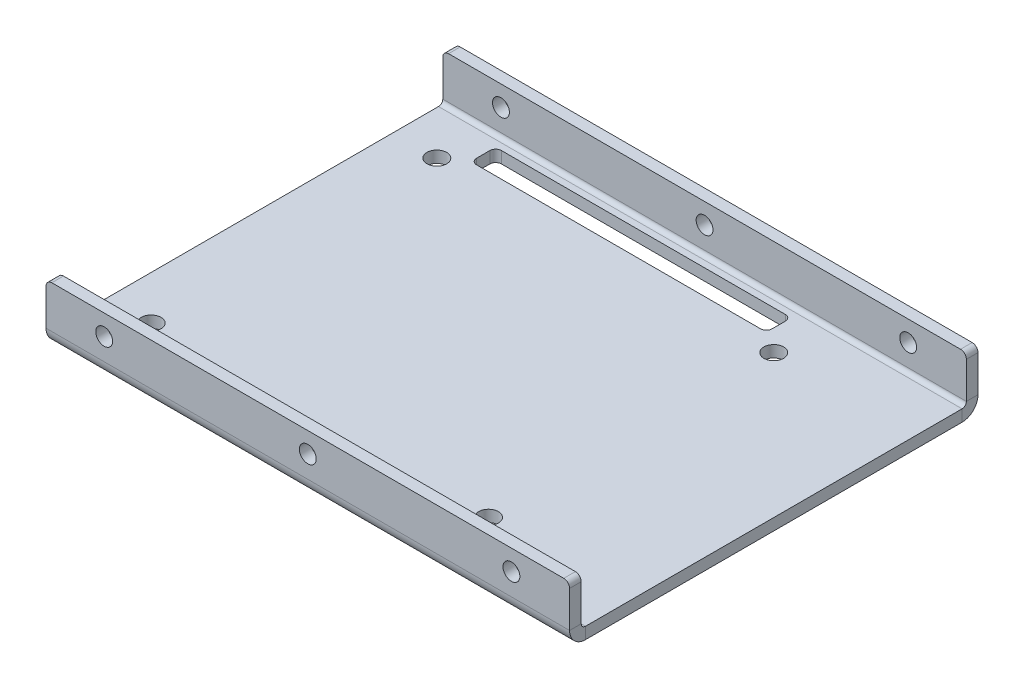
from build123d import *

# Parameters (mm, degrees)
SKETCH_1_W                         = 90
SKETCH_1_H                         = 70.2
SM_BASE_FLANGE_1_DEPTH             = 2
SM_EDGE_FLANGE_1_STRIP_W           = 9.4732
SM_EDGE_FLANGE_1_STRIP_H           = 2
SM_EDGE_FLANGE_1_STRIP_CUT_DEPTH   = 90
SM_EDGE_FLANGE_1_STRIP_2_W         = 9.4732
SM_EDGE_FLANGE_1_STRIP_2_H         = 2
SM_EDGE_FLANGE_1_STRIP_CUT_2_DEPTH = 90
SM_EDGE_FLANGE_1_DEPTH             = 90
SM_EDGE_FLANGE_1_BEND_DEPTH        = 90
SKETCH_12_W                        = 50.800050643
SKETCH_12_H                        = 4.268431417
CUT_EXTRUDE_1_DEPTH                = 10
FILLET_1_R                         = 1
FILLET_2_R                         = 1
HOLE_WIZARD_M2_5_2_D               = 2.9
HOLE_WIZARD_M3_1_D                 = 3.4


# Sheet-metal steps are written as plain solids
with BuildPart() as part:
    # Sketch 1 → 基体-法兰1 (new body)
    with BuildSketch(Plane(origin=(0, 0, 0), x_dir=(1, 0, 0), z_dir=(0, 1, 0))):
        Rectangle(SKETCH_1_W, SKETCH_1_H)
    extrude(amount=-SM_BASE_FLANGE_1_DEPTH)

    # 边线-法兰1 strip (across the edge) → 边线-法兰1 strip cut (cut)
    with BuildSketch(Plane(origin=(-45, 0, 35.1), x_dir=(0, 0, -1), z_dir=(1, 0, 0))):
        with Locations((-2, -1)):
            Rectangle(SM_EDGE_FLANGE_1_STRIP_W, SM_EDGE_FLANGE_1_STRIP_H)
    extrude(amount=SM_EDGE_FLANGE_1_STRIP_CUT_DEPTH, mode=Mode.SUBTRACT)

    # 边线-法兰1 strip 2 (across the edge) → 边线-法兰1 strip cut 2 (cut)
    with BuildSketch(Plane(origin=(45, 0, -35.1), x_dir=(0, 0, 1), z_dir=(-1, 0, 0))):
        with Locations((-2, -1)):
            Rectangle(SM_EDGE_FLANGE_1_STRIP_2_W, SM_EDGE_FLANGE_1_STRIP_2_H)
    extrude(amount=SM_EDGE_FLANGE_1_STRIP_CUT_2_DEPTH, mode=Mode.SUBTRACT)

    # 边线-法兰1 section (across the edge) → 边线-法兰1 (add)
    with BuildSketch(Plane(origin=(-45, 0, 35.1), x_dir=(0, 0, -1), z_dir=(1, 0, 0))):
        with BuildLine():
            Line((0, 0.7366), (0, 8))
            Line((0, 8), (2, 8))
            Line((2, 8), (2, 0.7366))
            ThreePointArc((2, 0.7366), (2.215745145, 0.215745145), (2.7366, 0))
            Line((2.7366, 0), (2.7366, -2))
            ThreePointArc((2.7366, -2), (0.801531583, -1.198468417), (0, 0.7366))
        make_face()
    extrude(amount=SM_EDGE_FLANGE_1_DEPTH)

    # 边线-法兰1 section 2 (across the edge) → 边线-法兰1 bend (add)
    with BuildSketch(Plane(origin=(45, 0, -35.1), x_dir=(0, 0, 1), z_dir=(-1, 0, 0))):
        with BuildLine():
            Line((0, 0.7366), (0, 8))
            Line((0, 8), (2, 8))
            Line((2, 8), (2, 0.7366))
            ThreePointArc((2, 0.7366), (2.215745145, 0.215745145), (2.7366, 0))
            Line((2.7366, 0), (2.7366, -2))
            ThreePointArc((2.7366, -2), (0.801531583, -1.198468417), (0, 0.7366))
        make_face()
    extrude(amount=SM_EDGE_FLANGE_1_BEND_DEPTH)

    # 草图12 → 切除-拉伸1 (cut)
    with BuildSketch(Plane(origin=(0, 0, 0), x_dir=(1, 0, 0), z_dir=(0, 1, 0))):
        with Locations((-8.635838808, 29.089367058)):
            Rectangle(SKETCH_12_W, SKETCH_12_H)
    extrude(amount=-CUT_EXTRUDE_1_DEPTH, mode=Mode.SUBTRACT)

    # 圆角1
    fillet_1_edges = [part.edges().sort_by_distance(p)[0] for p in [
        (-34.035864129, -1, -26.955151349),
        (-34.035864129, -1, -31.223582766),
        (16.764186514, -1, -31.223582766),
        (16.764186514, -1, -26.955151349),
    ]]
    fillet(fillet_1_edges, radius=FILLET_1_R)

    # 圆角2
    fillet_2_edges = [part.edges().sort_by_distance(p)[0] for p in [
        (-45, 8, 34.1),
        (45, 8, 34.1),
        (45, 8, -34.1),
        (-45, 8, -34.1),
    ]]
    fillet(fillet_2_edges, radius=FILLET_2_R)

    # M2.5 间隙孔2 (through all)
    with Locations(Plane.XY.offset(35.1)):
        with Locations((0, 4.5), (35, 4.5), (-35, 4.5)):
            Hole(HOLE_WIZARD_M2_5_2_D / 2)

    # M3 间隙孔1 (through all)
    with Locations(Plane(origin=(0, 0, 0), x_dir=(1, 0, 0), z_dir=(0, 1, 0))):
        with Locations((-37.464896876, -24.56505715), (-37.464896876, 24.542151638), (20.447218948, 24.542151638), (20.447218948, -24.479946406)):
            Hole(HOLE_WIZARD_M3_1_D / 2)


solid = part.part
